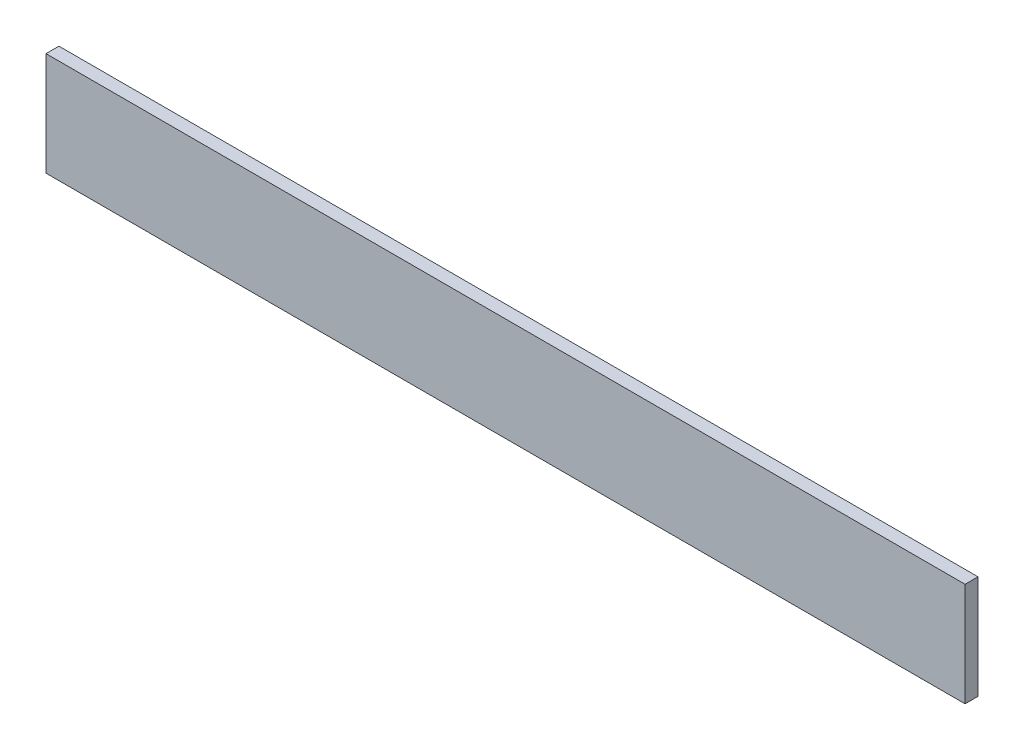
from build123d import *

# Parameters (mm, degrees)
SKETCH1_W           = 450.87
SKETCH1_H           = 50.8
BOSS_EXTRUDE1_DEPTH = 6.35


with BuildPart() as part:
    # Sketch1 → Boss-Extrude1 (new body)
    with BuildSketch(Plane.XY):
        Rectangle(SKETCH1_W, SKETCH1_H)
    extrude(amount=BOSS_EXTRUDE1_DEPTH)


solid = part.part
